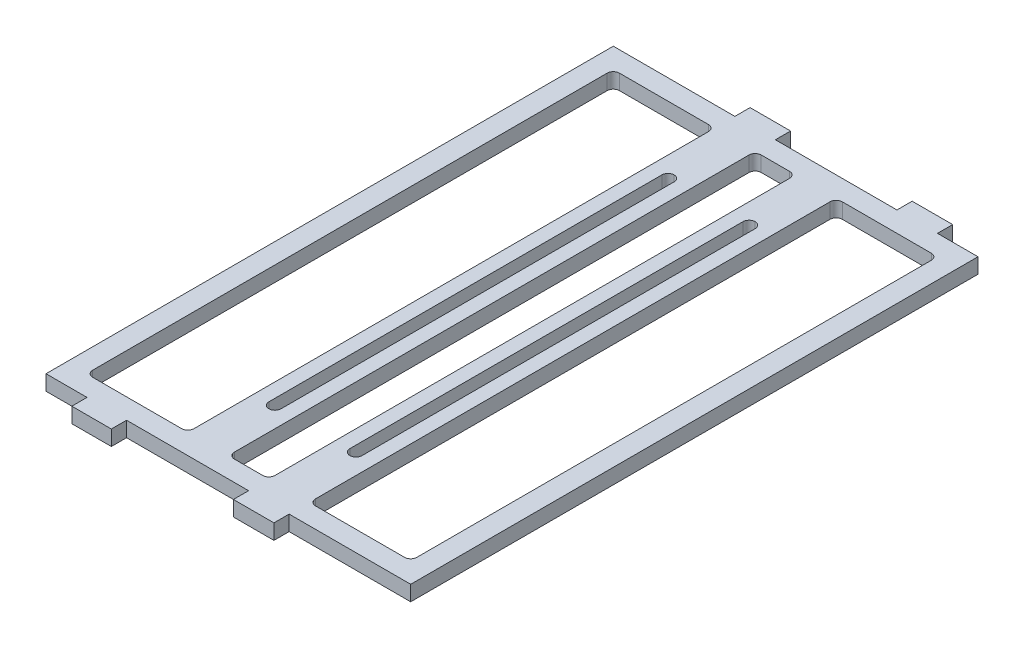
from build123d import *

# Parameters (mm, degrees)
SKETCH1_W           = 114.3
SKETCH1_H           = 177.8
SKETCH1_W_2         = 101.6
SKETCH1_H_2         = 165.1
BOSS_EXTRUDE1_DEPTH = 4.7625
SKETCH2_W           = 12.38677804
SKETCH2_H           = 4.7625
SKETCH2_W_2         = 12.7
BOSS_EXTRUDE2_DEPTH = 4.7625
SKETCH3_W           = 12.7
SKETCH3_H           = 4.7625
BOSS_EXTRUDE3_DEPTH = 4.7625
SKETCH4_W           = 12.7
SKETCH4_H           = 177.8
SKETCH4_W_2         = 3.81
SKETCH4_H_2         = 127
BOSS_EXTRUDE4_DEPTH = 4.7625
FILLET1_R           = 1.905


with BuildPart() as part:
    # Sketch1 → Boss-Extrude1 (new body)
    with BuildSketch(Plane(origin=(0, 0, 0), x_dir=(1, 0, 0), z_dir=(0, 1, 0))):
        Rectangle(SKETCH1_W, SKETCH1_H)
        Rectangle(SKETCH1_W_2, SKETCH1_H_2, mode=Mode.SUBTRACT)
    extrude(amount=BOSS_EXTRUDE1_DEPTH)

    # Sketch2 → Boss-Extrude2 (add)
    with BuildSketch(Plane.XY.offset(88.9)):
        with Locations((-38.1, 2.38125)):
            Rectangle(SKETCH2_W, SKETCH2_H)
        with Locations((12.7, 2.38125)):
            Rectangle(SKETCH2_W_2, SKETCH2_H)
    extrude(amount=BOSS_EXTRUDE2_DEPTH)

    # Sketch3 → Boss-Extrude3 (add)
    with BuildSketch(Plane(origin=(0, 0, -88.9), x_dir=(-1, 0, 0), z_dir=(0, 0, -1))):
        with Locations((-38.1, 2.38125)):
            Rectangle(SKETCH3_W, SKETCH3_H)
        with Locations((12.7, 2.38125)):
            Rectangle(SKETCH3_W, SKETCH3_H)
    extrude(amount=BOSS_EXTRUDE3_DEPTH)

    # Sketch4 → Boss-Extrude4 (add)
    # profile 1 of 2: a face of its own
    with BuildSketch(Plane(origin=(0, 4.7625, 0), x_dir=(-1, 0, 0), z_dir=(0, 1, 0))):
        with Locations((12.7, 0)):
            Rectangle(SKETCH4_W, SKETCH4_H)
        with Locations((12.7, 0)):
            Rectangle(SKETCH4_W_2, SKETCH4_H_2, mode=Mode.SUBTRACT)
    # profile 2 of 2: a face of its own
    with BuildSketch(Plane(origin=(0, 4.7625, 0), x_dir=(-1, 0, 0), z_dir=(0, 1, 0))):
        with Locations((-12.7, 0)):
            Rectangle(SKETCH4_W, SKETCH4_H)
        with Locations((-12.7, 0)):
            Rectangle(SKETCH4_W_2, SKETCH4_H_2, mode=Mode.SUBTRACT)
    extrude(amount=-BOSS_EXTRUDE4_DEPTH)

    # Fillet1
    fillet1_edges = [part.edges().sort_by_distance(p)[0] for p in [
        (-10.795, 2.38125, -63.5),
        (-14.605, 2.38125, -63.5),
        (10.795, 2.38125, -63.5),
        (14.605, 2.38125, -63.5),
        (-10.795, 2.38125, 63.5),
        (-14.605, 2.38125, 63.5),
        (10.795, 2.38125, 63.5),
        (14.605, 2.38125, 63.5),
        (-6.35, 2.38125, 82.55),
        (6.35, 2.38125, 82.55),
        (-6.35, 2.38125, -82.55),
        (6.35, 2.38125, -82.55),
        (-19.05, 2.38125, -82.55),
        (-50.8, 2.38125, -82.55),
        (-50.8, 2.38125, 82.55),
        (-19.05, 2.38125, 82.55),
        (19.05, 2.38125, 82.55),
        (50.8, 2.38125, 82.55),
        (19.05, 2.38125, -82.55),
        (50.8, 2.38125, -82.55),
    ]]
    fillet(fillet1_edges, radius=FILLET1_R - 0.0001)  # a hair under: the kernel refuses the full size


solid = part.part
